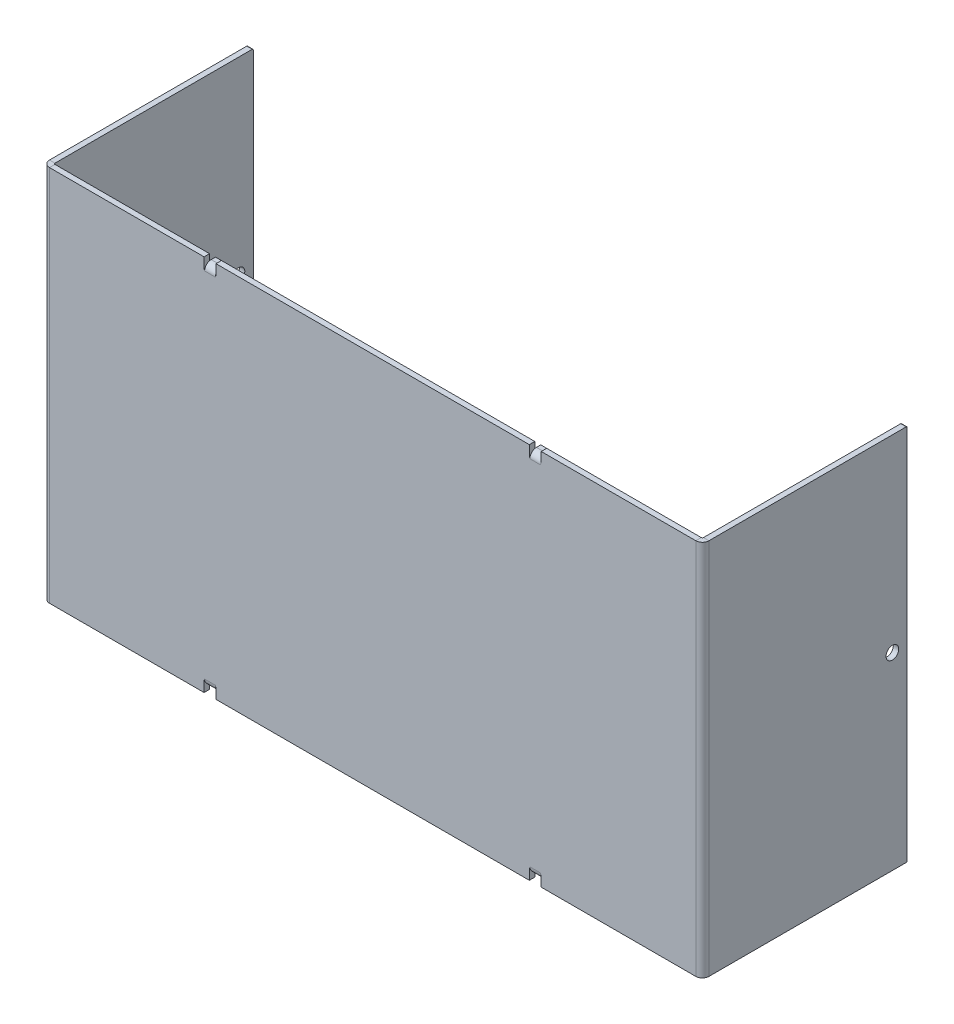
from build123d import *

# Parameters (mm, degrees)
SKETCH1_W                      = 152.4
SKETCH1_H                      = 88.9
BASE_FLANGE1_DEPTH             = 1.29032
EDGE_FLANGE1_STRIP_W           = 5.85978
EDGE_FLANGE1_STRIP_H           = 1.29032
EDGE_FLANGE1_STRIP_CUT_DEPTH   = 88.9
EDGE_FLANGE1_STRIP_2_W         = 5.85978
EDGE_FLANGE1_STRIP_2_H         = 1.29032
EDGE_FLANGE1_STRIP_CUT_2_DEPTH = 88.9
EDGE_FLANGE1_DEPTH             = 88.9
EDGE_FLANGE1_BEND_DEPTH        = 88.9
M3X0_5_TAPPED_HOLE1_REACH      = 170.648
M3X0_5_TAPPED_HOLE1_BORE_R     = 1.5
BREAK_CORNER1_START            = -77.68082
BREAK_CORNER1_DEPTH            = 155.36164
CUT_THICKEN1_START             = 41.91
CUT_THICKEN1_OUTLINE_W         = 0.127
CUT_THICKEN1_OUTLINE_H         = 1.29032
CUT_THICKEN1_DEPTH             = 2.54
CUT_THICKEN2_START             = 41.91
CUT_THICKEN2_OUTLINE_W         = 0.127
CUT_THICKEN2_OUTLINE_H         = 1.29032
CUT_THICKEN2_DEPTH             = 2.54
MIRROR7_START                  = 41.91
MIRROR7_COPY_1_SKETCH_W        = 0.127
MIRROR7_COPY_1_SKETCH_H        = 1.29032
MIRROR7_COPY_1_DEPTH           = 2.54
MIRROR7_COPY_2_SKETCH_W        = 0.127
MIRROR7_COPY_2_SKETCH_H        = 1.29032
MIRROR7_COPY_2_DEPTH           = 2.54
MOVE_FACE1_BY                  = 1.27
MOVE_FACE1_2_BY                = 1.27
MOVE_FACE1_3_BY                = 1.27
MOVE_FACE1_4_BY                = 1.27
EDGE_FLANGE2_STRIP_W           = 5.66928
EDGE_FLANGE2_STRIP_H           = 1.29032
EDGE_FLANGE2_STRIP_CUT_DEPTH   = 2.54
EDGE_FLANGE2_STRIP_2_W         = 5.66928
EDGE_FLANGE2_STRIP_2_H         = 1.29032
EDGE_FLANGE2_STRIP_CUT_2_DEPTH = 2.54
EDGE_FLANGE2_STRIP_3_W         = 5.66928
EDGE_FLANGE2_STRIP_3_H         = 1.29032
EDGE_FLANGE2_STRIP_CUT_3_DEPTH = 2.54
EDGE_FLANGE2_STRIP_4_W         = 5.66928
EDGE_FLANGE2_STRIP_4_H         = 1.29032
EDGE_FLANGE2_STRIP_CUT_4_DEPTH = 2.54
EDGE_FLANGE2_DEPTH             = 2.54
EDGE_FLANGE2_BEND_DEPTH        = 2.54
EDGE_FLANGE2_BEND_2_DEPTH      = 2.54
EDGE_FLANGE2_BEND_3_DEPTH      = 2.54


# Read off the part's stored shape, not the designer's step: Break-Corner1, Cut-Thicken1, Cut-Thicken2
# Sheet-metal steps are written as plain solids
with BuildPart() as part:
    # Sketch1 → Base-Flange1 (new body)
    with BuildSketch(Plane.XY):
        Rectangle(SKETCH1_W, SKETCH1_H)
    extrude(amount=-BASE_FLANGE1_DEPTH)

    # Edge-Flange1 strip (across the edge) → Edge-Flange1 strip cut (cut)
    with BuildSketch(Plane(origin=(-76.3905, -44.45, -1.29032), x_dir=(1, 0, 0), z_dir=(0, 1, 0))):
        with Locations((-2.67589, -0.64516)):
            Rectangle(EDGE_FLANGE1_STRIP_W, EDGE_FLANGE1_STRIP_H)
    extrude(amount=EDGE_FLANGE1_STRIP_CUT_DEPTH, mode=Mode.SUBTRACT)

    # Edge-Flange1 strip 2 (across the edge) → Edge-Flange1 strip cut 2 (cut)
    with BuildSketch(Plane(origin=(76.3905, 44.45, -1.29032), x_dir=(-1, 0, 0), z_dir=(0, -1, 0))):
        with Locations((-2.67589, -0.64516)):
            Rectangle(EDGE_FLANGE1_STRIP_2_W, EDGE_FLANGE1_STRIP_2_H)
    extrude(amount=EDGE_FLANGE1_STRIP_CUT_2_DEPTH, mode=Mode.SUBTRACT)

    # Edge-Flange1 section (across the edge) → Edge-Flange1 (add)
    with BuildSketch(Plane(origin=(-76.3905, -44.45, -1.29032), x_dir=(1, 0, 0), z_dir=(0, 1, 0))):
        with BuildLine():
            Line((-1.29032, 0.254), (-1.29032, 46.96968))
            Line((-1.29032, 46.96968), (0, 46.96968))
            Line((0, 46.96968), (0, 0.254))
            ThreePointArc((0, 0.254), (0.074394878, 0.074394878), (0.254, 0))
            Line((0.254, 0), (0.254, -1.29032))
            ThreePointArc((0.254, -1.29032), (-0.837999144, -0.837999144), (-1.29032, 0.254))
        make_face()
    extrude(amount=EDGE_FLANGE1_DEPTH)

    # Edge-Flange1 section 2 (across the edge) → Edge-Flange1 bend (add)
    with BuildSketch(Plane(origin=(76.3905, 44.45, -1.29032), x_dir=(-1, 0, 0), z_dir=(0, -1, 0))):
        with BuildLine():
            Line((-1.29032, 0.254), (-1.29032, 46.96968))
            Line((-1.29032, 46.96968), (0, 46.96968))
            Line((0, 46.96968), (0, 0.254))
            ThreePointArc((0, 0.254), (0.074394878, 0.074394878), (0.254, 0))
            Line((0.254, 0), (0.254, -1.29032))
            ThreePointArc((0.254, -1.29032), (-0.837999144, -0.837999144), (-1.29032, 0.254))
        make_face()
    extrude(amount=EDGE_FLANGE1_BEND_DEPTH)

    # M3x0.5 Tapped Hole1 bore → M3x0.5 Tapped Hole1 (cut, up to next)
    with BuildSketch(Plane.ZY.offset(77.68082), mode=Mode.PRIVATE) as m3x0_5_tapped_hole1_sk1:
        with Locations((-44.7675, 0)):
            Circle(M3X0_5_TAPPED_HOLE1_BORE_R)
    m3x0_5_tapped_hole1_tool1 = extrude(m3x0_5_tapped_hole1_sk1.sketch, amount=-M3X0_5_TAPPED_HOLE1_REACH, mode=Mode.PRIVATE) & part.part
    m3x0_5_tapped_hole1 = m3x0_5_tapped_hole1_tool1.solids().sort_by_distance((-77.68082, 0, -44.7675))[0]
    add(m3x0_5_tapped_hole1, mode=Mode.SUBTRACT)

    # Mirror1: M3x0.5 Tapped Hole1 across plane
    add(m3x0_5_tapped_hole1.mirror(Plane(origin=(0, 0, 0), x_dir=(0, 0, 1), z_dir=(1, 0, 0))), mode=Mode.SUBTRACT)

    # Break-Corner1 outline → Break-Corner1 (cut)
    with BuildSketch(Plane.YZ.offset(BREAK_CORNER1_START)):
        with BuildLine():
            Line((44.45, -48.26), (44.45, -48.006))
            ThreePointArc((44.45, -48.006), (44.375605122, -48.185605122), (44.196, -48.26))
            Line((44.196, -48.26), (44.45, -48.26))
        make_face()
        with BuildLine():
            Line((-44.45, -48.26), (-44.196, -48.26))
            ThreePointArc((-44.196, -48.26), (-44.375605122, -48.185605122), (-44.45, -48.006))
            Line((-44.45, -48.006), (-44.45, -48.26))
        make_face()
    extrude(amount=BREAK_CORNER1_DEPTH, mode=Mode.SUBTRACT)

    # Cut-Thicken1 outline → Cut-Thicken1 (cut)
    with BuildSketch(Plane(origin=(0, 0, 0), x_dir=(1, 0, 0), z_dir=(0, 1, 0)).offset(CUT_THICKEN1_START)):
        with Locations((36.97732, 0.64516)):
            Rectangle(CUT_THICKEN1_OUTLINE_W, CUT_THICKEN1_OUTLINE_H)
    cut_thicken1 = extrude(amount=CUT_THICKEN1_DEPTH, mode=Mode.SUBTRACT)

    # Cut-Thicken2 outline → Cut-Thicken2 (cut)
    with BuildSketch(Plane(origin=(0, 0, 0), x_dir=(1, 0, 0), z_dir=(0, 1, 0)).offset(CUT_THICKEN2_START)):
        with Locations((39.64432, 0.64516)):
            Rectangle(CUT_THICKEN2_OUTLINE_W, CUT_THICKEN2_OUTLINE_H)
    cut_thicken2 = extrude(amount=CUT_THICKEN2_DEPTH, mode=Mode.SUBTRACT)

    # Mirror6: Cut-Thicken1, Cut-Thicken2 across plane
    add(cut_thicken1.mirror(Plane(origin=(0, 0, 0), x_dir=(0, 0, 1), z_dir=(1, 0, 0))), mode=Mode.SUBTRACT)
    add(cut_thicken2.mirror(Plane(origin=(0, 0, 0), x_dir=(0, 0, 1), z_dir=(1, 0, 0))), mode=Mode.SUBTRACT)

    # Mirror7: Cut-Thicken1, Cut-Thicken2 across plane
    add(cut_thicken1.mirror(Plane.ZX), mode=Mode.SUBTRACT)
    add(cut_thicken2.mirror(Plane.ZX), mode=Mode.SUBTRACT)

    # Mirror7 copy 1 sketch → Mirror7 copy 1 (cut)
    with BuildSketch(Plane(origin=(0, 0, 0), x_dir=(-1, 0, 0), z_dir=(0, -1, 0)).offset(MIRROR7_START)):
        with Locations((36.97732, 0.64516)):
            Rectangle(MIRROR7_COPY_1_SKETCH_W, MIRROR7_COPY_1_SKETCH_H)
    extrude(amount=MIRROR7_COPY_1_DEPTH, mode=Mode.SUBTRACT)

    # Mirror7 copy 2 sketch → Mirror7 copy 2 (cut)
    with BuildSketch(Plane(origin=(0, 0, 0), x_dir=(-1, 0, 0), z_dir=(0, -1, 0)).offset(MIRROR7_START)):
        with Locations((39.64432, 0.64516)):
            Rectangle(MIRROR7_COPY_2_SKETCH_W, MIRROR7_COPY_2_SKETCH_H)
    extrude(amount=MIRROR7_COPY_2_DEPTH, mode=Mode.SUBTRACT)

    # Move Face1: a face moved inward by 1.27
    extrude(part.faces().sort_by_distance((-38.31082, -44.45, -0.64516))[0], amount=MOVE_FACE1_BY, dir=(0, 1, 0), mode=Mode.SUBTRACT)

    # Move Face1 2: a face moved inward by 1.27
    extrude(part.faces().sort_by_distance((38.31082, -44.45, -0.64516))[0], amount=MOVE_FACE1_2_BY, dir=(0, 1, 0), mode=Mode.SUBTRACT)

    # Move Face1 3: a face moved inward by 1.27
    extrude(part.faces().sort_by_distance((-38.31082, 44.45, -0.64516))[0], amount=MOVE_FACE1_3_BY, dir=(0, -1, 0), mode=Mode.SUBTRACT)

    # Move Face1 4: a face moved inward by 1.27
    extrude(part.faces().sort_by_distance((38.31082, 44.45, -0.64516))[0], amount=MOVE_FACE1_4_BY, dir=(0, -1, 0), mode=Mode.SUBTRACT)

    # Edge-Flange2 strip (across the edge) → Edge-Flange2 strip cut (cut)
    with BuildSketch(Plane(origin=(37.04082, 43.18, -1.29032), x_dir=(0, -1, 0), z_dir=(1, 0, 0))):
        with Locations((-1.29032, -0.64516)):
            Rectangle(EDGE_FLANGE2_STRIP_W, EDGE_FLANGE2_STRIP_H)
    extrude(amount=EDGE_FLANGE2_STRIP_CUT_DEPTH, mode=Mode.SUBTRACT)

    # Edge-Flange2 strip 2 (across the edge) → Edge-Flange2 strip cut 2 (cut)
    with BuildSketch(Plane(origin=(-39.58082, 43.18, -1.29032), x_dir=(0, -1, 0), z_dir=(1, 0, 0))):
        with Locations((-1.29032, -0.64516)):
            Rectangle(EDGE_FLANGE2_STRIP_2_W, EDGE_FLANGE2_STRIP_2_H)
    extrude(amount=EDGE_FLANGE2_STRIP_CUT_2_DEPTH, mode=Mode.SUBTRACT)

    # Edge-Flange2 strip 3 (across the edge) → Edge-Flange2 strip cut 3 (cut)
    with BuildSketch(Plane(origin=(39.58082, -43.18, -1.29032), x_dir=(0, 1, 0), z_dir=(-1, 0, 0))):
        with Locations((-1.29032, -0.64516)):
            Rectangle(EDGE_FLANGE2_STRIP_3_W, EDGE_FLANGE2_STRIP_3_H)
    extrude(amount=EDGE_FLANGE2_STRIP_CUT_3_DEPTH, mode=Mode.SUBTRACT)

    # Edge-Flange2 strip 4 (across the edge) → Edge-Flange2 strip cut 4 (cut)
    with BuildSketch(Plane(origin=(-37.04082, -43.18, -1.29032), x_dir=(0, 1, 0), z_dir=(-1, 0, 0))):
        with Locations((-1.29032, -0.64516)):
            Rectangle(EDGE_FLANGE2_STRIP_4_W, EDGE_FLANGE2_STRIP_4_H)
    extrude(amount=EDGE_FLANGE2_STRIP_CUT_4_DEPTH, mode=Mode.SUBTRACT)

    # Edge-Flange2 section (across the edge) → Edge-Flange2 (add)
    with BuildSketch(Plane(origin=(37.04082, 43.18, -1.29032), x_dir=(0, -1, 0), z_dir=(1, 0, 0))):
        with BuildLine():
            Line((0, 0.254), (0, 1.27))
            Line((0, 1.27), (1.29032, 1.27))
            Line((1.29032, 1.27), (1.29032, 0.254))
            ThreePointArc((1.29032, 0.254), (1.364714878, 0.074394878), (1.54432, 0))
            Line((1.54432, 0), (1.54432, -1.29032))
            ThreePointArc((1.54432, -1.29032), (0.452320856, -0.837999144), (0, 0.254))
        make_face()
    extrude(amount=EDGE_FLANGE2_DEPTH)

    # Edge-Flange2 section 2 (across the edge) → Edge-Flange2 bend (add)
    with BuildSketch(Plane(origin=(-39.58082, 43.18, -1.29032), x_dir=(0, -1, 0), z_dir=(1, 0, 0))):
        with BuildLine():
            Line((0, 0.254), (0, 1.27))
            Line((0, 1.27), (1.29032, 1.27))
            Line((1.29032, 1.27), (1.29032, 0.254))
            ThreePointArc((1.29032, 0.254), (1.364714878, 0.074394878), (1.54432, 0))
            Line((1.54432, 0), (1.54432, -1.29032))
            ThreePointArc((1.54432, -1.29032), (0.452320856, -0.837999144), (0, 0.254))
        make_face()
    extrude(amount=EDGE_FLANGE2_BEND_DEPTH)

    # Edge-Flange2 section 3 (across the edge) → Edge-Flange2 bend 2 (add)
    with BuildSketch(Plane(origin=(39.58082, -43.18, -1.29032), x_dir=(0, 1, 0), z_dir=(-1, 0, 0))):
        with BuildLine():
            Line((0, 0.254), (0, 1.27))
            Line((0, 1.27), (1.29032, 1.27))
            Line((1.29032, 1.27), (1.29032, 0.254))
            ThreePointArc((1.29032, 0.254), (1.364714878, 0.074394878), (1.54432, 0))
            Line((1.54432, 0), (1.54432, -1.29032))
            ThreePointArc((1.54432, -1.29032), (0.452320856, -0.837999144), (0, 0.254))
        make_face()
    extrude(amount=EDGE_FLANGE2_BEND_2_DEPTH)

    # Edge-Flange2 section 4 (across the edge) → Edge-Flange2 bend 3 (add)
    with BuildSketch(Plane(origin=(-37.04082, -43.18, -1.29032), x_dir=(0, 1, 0), z_dir=(-1, 0, 0))):
        with BuildLine():
            Line((0, 0.254), (0, 1.27))
            Line((0, 1.27), (1.29032, 1.27))
            Line((1.29032, 1.27), (1.29032, 0.254))
            ThreePointArc((1.29032, 0.254), (1.364714878, 0.074394878), (1.54432, 0))
            Line((1.54432, 0), (1.54432, -1.29032))
            ThreePointArc((1.54432, -1.29032), (0.452320856, -0.837999144), (0, 0.254))
        make_face()
    extrude(amount=EDGE_FLANGE2_BEND_3_DEPTH)


solid = part.part
